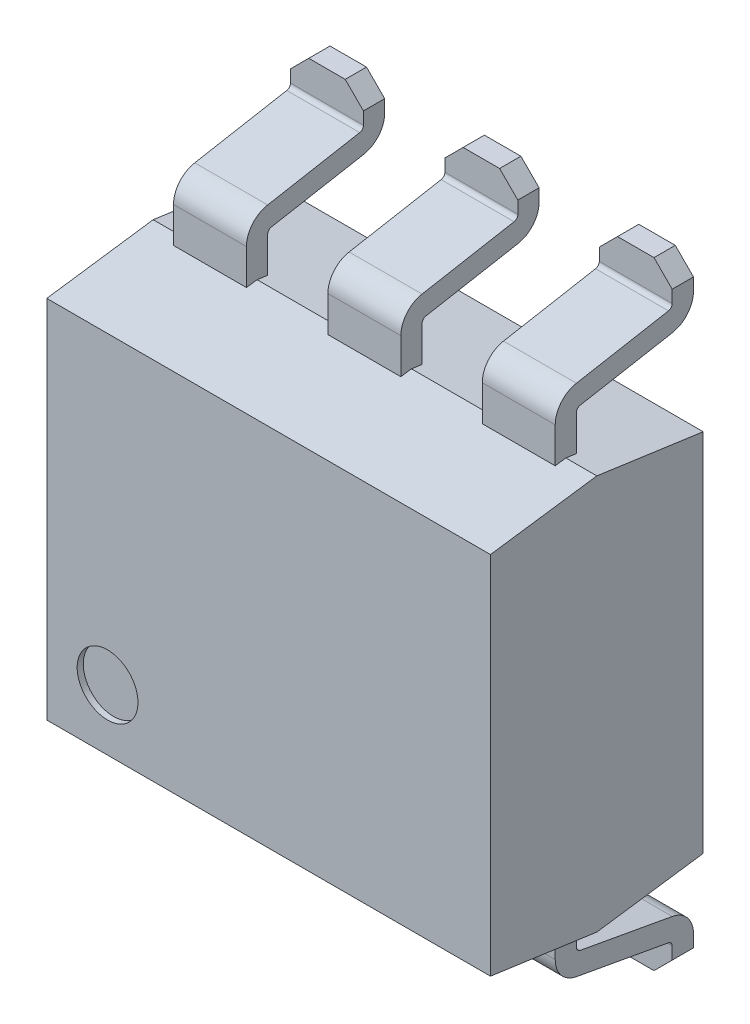
from build123d import *

# Parameters (mm, degrees)
SKETCH1_W           = 7.3
SKETCH1_H           = 6.5
BOSS_EXTRUDE1_DEPTH = 1.75
SKETCH2_W           = 7.3
SKETCH2_H           = 6.5
BOSS_EXTRUDE2_DEPTH = 1.75
DRAFT1_ANGLE        = 8
DRAFT2_ANGLE        = -8
EXTRUDE_THIN2_DEPTH = 0.6
LPATTERN1_COUNT     = 3
LPATTERN1_PITCH     = 2.54
CHAMFER1_SIZE       = 0.3
CHAMFER2_SIZE       = 0.3
CHAMFER3_SIZE       = 0.3
MIRROR1_START       = 0.51
MIRROR1_DEPTH       = 1.2
MIRROR1_START_2     = 3.05
MIRROR1_2_DEPTH     = 1.2
MIRROR1_START_3     = 5.59
MIRROR1_3_DEPTH     = 1.2
MIRROR1_START_4     = -5.529575029
MIRROR1_4_OUTLINE_W = 7.887220049
MIRROR1_4_OUTLINE_H = 0.35
MIRROR1_4_DEPTH     = 0.212132034
MIRROR1_START_5     = -5.317442995
MIRROR1_5_OUTLINE_W = 1.796051224
MIRROR1_5_OUTLINE_H = 0.35
MIRROR1_5_DEPTH     = 1.796051225
MIRROR1_START_6     = -3.369650441
MIRROR1_6_OUTLINE_W = 1.796051224
MIRROR1_6_OUTLINE_H = 0.35
MIRROR1_6_DEPTH     = 1.644309895
MIRROR1_START_7     = -1.573599217
MIRROR1_7_OUTLINE_W = 1.520677503
MIRROR1_7_OUTLINE_H = 0.35
MIRROR1_7_DEPTH     = 0.84090524
SKETCH4_R           = 0.5
CUT_EXTRUDE1_DEPTH  = 0.1


with BuildPart() as part:
    # Sketch1 → Boss-Extrude1 (new body)
    with BuildSketch(Plane.XY.offset(1.75)):
        with Locations((3.65, 3.25)):
            Rectangle(SKETCH1_W, SKETCH1_H)
    extrude(amount=BOSS_EXTRUDE1_DEPTH)

    # Draft1
    draft1_faces = [part.faces().sort_by_distance(p)[0] for p in [
        (3.65, 6.5, 2.625),
        (3.65, 0, 2.625),
    ]]
    draft(draft1_faces, Plane.XY.offset(1.75), DRAFT1_ANGLE)



with BuildPart() as body_2:
    # Sketch2 → Boss-Extrude2 (new body)
    with BuildSketch(Plane.XY.offset(1.75)):
        with Locations((3.65, 3.25)):
            Rectangle(SKETCH2_W, SKETCH2_H)
    extrude(amount=-BOSS_EXTRUDE2_DEPTH)

    # Draft2
    draft2_faces = [body_2.faces().sort_by_distance(p)[0] for p in [
        (3.65, 6.5, 0.875),
        (3.65, 0, 0.875),
    ]]
    draft(draft2_faces, Plane.XY.offset(1.75), DRAFT2_ANGLE)


with BuildPart() as body_3:
    # Sketch3 → Extrude-Thin2 (new, symmetric)
    with BuildSketch(Plane(origin=(6.19, 0, 0), x_dir=(0, 0, -1), z_dir=(1, 0, 0))):
        with BuildLine():
            Line((-1.925, 0.113838246), (-1.925, -0.56))
            ThreePointArc((-1.925, -0.56), (-1.826198499, -0.832432633), (-1.575731579, -0.978198192))
            Line((-1.575731579, -0.978198192), (-0.061635604, -1.252386078))
            ThreePointArc((-0.061635604, -1.252386078), (-0.017435559, -1.278109412), (0, -1.326185759))
            Line((0, -1.326185759), (0, -1.83))
            Line((0, -1.83), (0.35, -1.83))
            Line((0.35, -1.83), (0.35, -1.326185759))
            ThreePointArc((0.35, -1.326185759), (0.251198499, -1.053753126), (0.000731579, -0.907987567))
            Line((0.000731579, -0.907987567), (-1.513364396, -0.633799681))
            ThreePointArc((-1.513364396, -0.633799681), (-1.557564441, -0.608076347), (-1.575, -0.56))
            Line((-1.575, -0.56), (-1.575, 0.113838246))
            Line((-1.575, 0.113838246), (-1.925, 0.113838246))
        make_face()
    extrude_thin2 = extrude(amount=EXTRUDE_THIN2_DEPTH, both=True)

    # Chamfer1
    chamfer1_edges = [body_3.edges().sort_by_distance(p)[0] for p in [
        (5.59, -1.83, -0.175),
        (6.79, -1.83, -0.175),
    ]]
    chamfer(chamfer1_edges, length=CHAMFER1_SIZE)


with BuildPart() as lpattern1_1:
    # LPattern1: pattern copy
    add(extrude_thin2.moved(Location(Vector(-1, 0, 0) * (1 * LPATTERN1_PITCH))))

    # Chamfer2
    chamfer2_edges = [lpattern1_1.edges().sort_by_distance(p)[0] for p in [
        (3.05, -1.83, -0.175),
        (4.25, -1.83, -0.175),
    ]]
    chamfer(chamfer2_edges, length=CHAMFER2_SIZE)


with BuildPart() as lpattern1_2:
    # LPattern1: pattern copy
    add(extrude_thin2.moved(Location(Vector(-1, 0, 0) * (2 * LPATTERN1_PITCH))))

    # Chamfer3
    chamfer3_edges = [lpattern1_2.edges().sort_by_distance(p)[0] for p in [
        (0.51, -1.83, -0.175),
        (1.71, -1.83, -0.175),
    ]]
    chamfer(chamfer3_edges, length=CHAMFER3_SIZE)


with BuildPart() as part_1:
    add(part.part)

    add(body_2.part)  # Mirror1 merges body 2
    # Mirror1: read off the stored shape, not the designer's step
    # Mirror1 outline → Mirror1 (add)
    with BuildSketch(Plane.YZ.offset(MIRROR1_START)):
        with BuildLine():
            Line((8.33, 0), (7.826185759, 0))
            ThreePointArc((7.826185759, 0), (7.778109412, 0.017435559), (7.752386078, 0.061635604))
            Line((7.752386078, 0.061635604), (7.478198192, 1.575731579))
            ThreePointArc((7.478198192, 1.575731579), (7.332432633, 1.826198499), (7.06, 1.925))
            Line((7.06, 1.925), (6.475405354, 1.925))
            Line((6.475405354, 1.925), (6.5, 1.75))
            Line((6.5, 1.75), (6.475405354, 1.575))
            Line((6.475405354, 1.575), (7.06, 1.575))
            ThreePointArc((7.06, 1.575), (7.108076347, 1.557564441), (7.133799681, 1.513364396))
            Line((7.133799681, 1.513364396), (7.407987567, -0.000731579))
            ThreePointArc((7.407987567, -0.000731579), (7.553753126, -0.251198499), (7.826185759, -0.35))
            Line((7.826185759, -0.35), (8.33, -0.35))
            Line((8.33, -0.35), (8.33, 0))
        make_face()
    extrude(amount=MIRROR1_DEPTH)

    # Mirror1 2 outline → Mirror1 2 (add)
    with BuildSketch(Plane.YZ.offset(MIRROR1_START_2)):
        with BuildLine():
            Line((8.33, 0), (7.826185759, 0))
            ThreePointArc((7.826185759, 0), (7.778109412, 0.017435559), (7.752386078, 0.061635604))
            Line((7.752386078, 0.061635604), (7.478198192, 1.575731579))
            ThreePointArc((7.478198192, 1.575731579), (7.332432633, 1.826198499), (7.06, 1.925))
            Line((7.06, 1.925), (6.475405354, 1.925))
            Line((6.475405354, 1.925), (6.5, 1.75))
            Line((6.5, 1.75), (6.475405354, 1.575))
            Line((6.475405354, 1.575), (7.06, 1.575))
            ThreePointArc((7.06, 1.575), (7.108076347, 1.557564441), (7.133799681, 1.513364396))
            Line((7.133799681, 1.513364396), (7.407987567, -0.000731579))
            ThreePointArc((7.407987567, -0.000731579), (7.553753126, -0.251198499), (7.826185759, -0.35))
            Line((7.826185759, -0.35), (8.33, -0.35))
            Line((8.33, -0.35), (8.33, 0))
        make_face()
    extrude(amount=MIRROR1_2_DEPTH)

    # Mirror1 3 outline → Mirror1 3 (add)
    with BuildSketch(Plane.YZ.offset(MIRROR1_START_3)):
        with BuildLine():
            Line((8.33, 0), (7.826185759, 0))
            ThreePointArc((7.826185759, 0), (7.778109412, 0.017435559), (7.752386078, 0.061635604))
            Line((7.752386078, 0.061635604), (7.478198192, 1.575731579))
            ThreePointArc((7.478198192, 1.575731579), (7.332432633, 1.826198499), (7.06, 1.925))
            Line((7.06, 1.925), (6.475405354, 1.925))
            Line((6.475405354, 1.925), (6.5, 1.75))
            Line((6.5, 1.75), (6.475405354, 1.575))
            Line((6.475405354, 1.575), (7.06, 1.575))
            ThreePointArc((7.06, 1.575), (7.108076347, 1.557564441), (7.133799681, 1.513364396))
            Line((7.133799681, 1.513364396), (7.407987567, -0.000731579))
            ThreePointArc((7.407987567, -0.000731579), (7.553753126, -0.251198499), (7.826185759, -0.35))
            Line((7.826185759, -0.35), (8.33, -0.35))
            Line((8.33, -0.35), (8.33, 0))
        make_face()
    extrude(amount=MIRROR1_3_DEPTH)

    # Mirror1 4 outline → Mirror1 4 (cut)
    with BuildSketch(Plane(origin=(0, 0, 0), x_dir=(0.7071067811865483, 0.7071067811865467, 0), z_dir=(0.7071067811865466, -0.7071067811865486, 0)).offset(MIRROR1_START_4)):
        with Locations((2.943610025, -0.175)):
            Rectangle(MIRROR1_4_OUTLINE_W, MIRROR1_4_OUTLINE_H)
    extrude(amount=MIRROR1_4_DEPTH, mode=Mode.SUBTRACT)

    # Mirror1 5 outline → Mirror1 5 (cut)
    with BuildSketch(Plane(origin=(0, 0, 0), x_dir=(0.7071067811865483, 0.7071067811865467, 0), z_dir=(0.7071067811865466, -0.7071067811865486, 0)).offset(MIRROR1_START_5)):
        with Locations((7.785245661, -0.175)):
            Rectangle(MIRROR1_5_OUTLINE_W, MIRROR1_5_OUTLINE_H)
    extrude(amount=MIRROR1_5_DEPTH, mode=Mode.SUBTRACT)

    # Mirror1 6 outline → Mirror1 6 (cut)
    with BuildSketch(Plane(origin=(0, 0, 0), x_dir=(0.7071067811865483, 0.7071067811865467, 0), z_dir=(0.7071067811865466, -0.7071067811865486, 0)).offset(MIRROR1_START_6)):
        with Locations((9.581296885, -0.175)):
            Rectangle(MIRROR1_6_OUTLINE_W, MIRROR1_6_OUTLINE_H)
    extrude(amount=MIRROR1_6_DEPTH, mode=Mode.SUBTRACT)

    # Mirror1 7 outline → Mirror1 7 (cut)
    with BuildSketch(Plane(origin=(0, 0, 0), x_dir=(0.7071067811865483, 0.7071067811865467, 0), z_dir=(0.7071067811865466, -0.7071067811865486, 0)).offset(MIRROR1_START_7)):
        with Locations((11.239661248, -0.175)):
            Rectangle(MIRROR1_7_OUTLINE_W, MIRROR1_7_OUTLINE_H)
    extrude(amount=MIRROR1_7_DEPTH, mode=Mode.SUBTRACT)

    # Sketch4 → Cut-Extrude1 (cut)
    with BuildSketch(Plane.XY.offset(3.5)):
        with Locations((1, 1.245946461)):
            Circle(SKETCH4_R)
    extrude(amount=-CUT_EXTRUDE1_DEPTH, mode=Mode.SUBTRACT)


solid = Compound([body_3.part, lpattern1_1.part, lpattern1_2.part, part_1.part])
